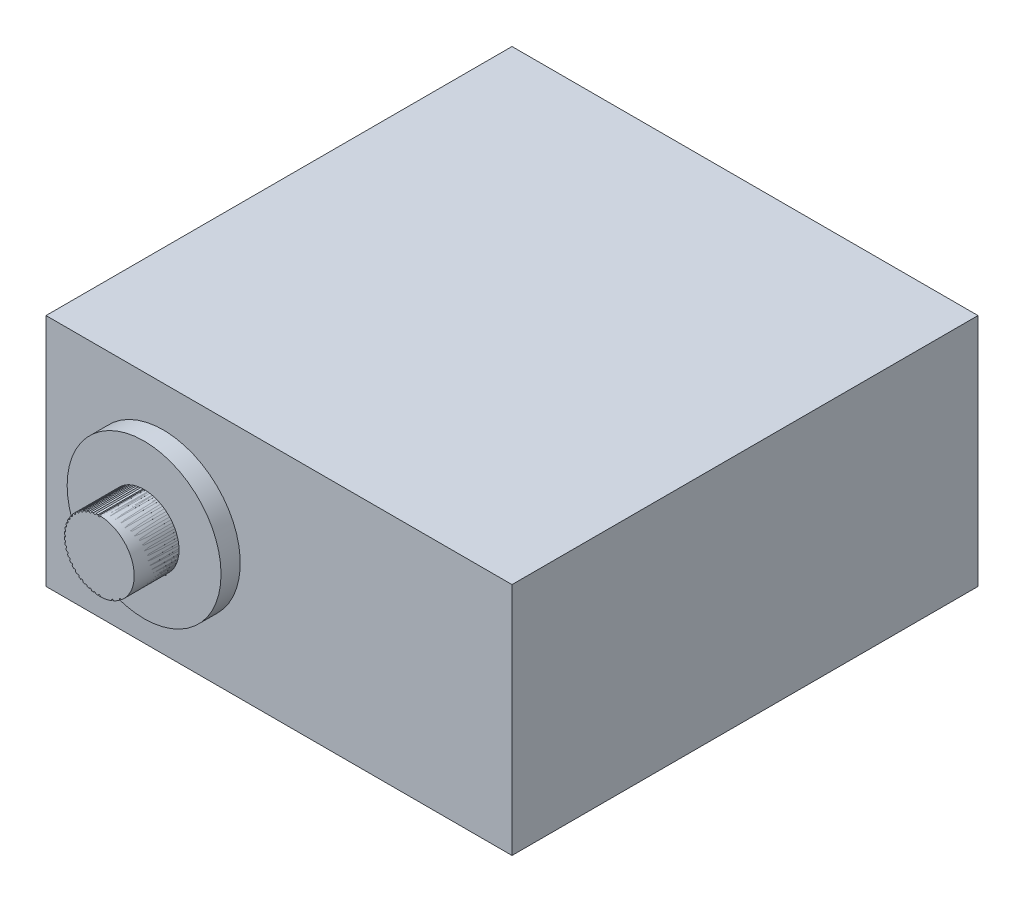
from build123d import *

# Parameters (mm, degrees)
SKETCH_1_W              = 40
SKETCH_1_H              = 20.14
EXTRUDE_1_DEPTH         = 40
SKETCH_2_R              = 6.605
SKETCH_2_R_2            = 3
EXTRUDE_2_DEPTH         = 1.65
SKETCH_3_R              = 3
EXTRUDE_3_DEPTH         = 5.5
SKETCH_4_R              = 6.605
SKETCH_4_R_2            = 3
EXTRUDE_4_DEPTH         = 1.65
SKETCH_5_R              = 3
EXTRUDE_5_DEPTH         = 5.55
CUT_EXTRUDE_START       = -3.9
CUT_EXTRUDE_1_OUTLINE_R = 0.1
CUT_EXTRUDE_1_DEPTH     = 3.9


# Read off the part's stored shape, not the designer's step: 切除-拉伸1
with BuildPart() as part:
    # 草图1 → 凸台-拉伸1 (new body)
    with BuildSketch(Plane.XY):
        Rectangle(SKETCH_1_W, SKETCH_1_H)
    extrude(amount=EXTRUDE_1_DEPTH)

    # 草图2 → 凸台-拉伸2 (add)
    with BuildSketch(Plane.XY.offset(40)):
        with Locations(Location((-9.93, 0, 0), (0, 0, 180))):
            Circle(SKETCH_2_R)
        with Locations((-9.93, 0)):
            Circle(SKETCH_2_R_2, mode=Mode.SUBTRACT)
    extrude(amount=EXTRUDE_2_DEPTH)

    # 草图3 → 凸台-拉伸3 (add)
    with BuildSketch(Plane.XY.offset(40)):
        with Locations((-9.93, 0)):
            Circle(SKETCH_3_R)
    extrude(amount=EXTRUDE_3_DEPTH)

    # 草图4 → 凸台-拉伸4 (add)
    with BuildSketch(Plane(origin=(0, 0, 0), x_dir=(-1, 0, 0), z_dir=(0, 0, -1))):
        with Locations((9.925, 0)):
            Circle(SKETCH_4_R)
        with Locations((9.925, 0)):
            Circle(SKETCH_4_R_2, mode=Mode.SUBTRACT)
    extrude(amount=EXTRUDE_4_DEPTH)

    # 草图5 → 凸台-拉伸5 (add)
    with BuildSketch(Plane(origin=(0, 0, 0), x_dir=(-1, 0, 0), z_dir=(0, 0, -1))):
        with Locations((9.925, 0)):
            Circle(SKETCH_5_R)
    extrude(amount=EXTRUDE_5_DEPTH)

    # 切除-拉伸1 outline → 切除-拉伸1 (cut)
    with BuildSketch(Plane.XY.offset(45.5).offset(CUT_EXTRUDE_START)):
        with BuildLine():
            ThreePointArc((-6.933434762, -0.09998611), (-6.931768095, 0), (-6.933434762, 0.09998611))
            ThreePointArc((-6.933434762, 0.09998611), (-7.031768095, 0), (-6.933434762, -0.09998611))
        make_face()
        with BuildLine():
            ThreePointArc((-6.972136725, 0.490491748), (-7.056577997, 0.378525958), (-6.946035113, 0.292230318))
            ThreePointArc((-6.946035113, 0.292230318), (-6.957433511, 0.391578577), (-6.972136725, 0.490491748))
        make_face()
        with BuildLine():
            ThreePointArc((-6.972136725, -0.490491748), (-6.957433511, -0.391578577), (-6.946035113, -0.292230318))
            ThreePointArc((-6.946035113, -0.292230318), (-7.056577997, -0.378525958), (-6.972136725, -0.490491748))
        make_face()
        with BuildLine():
            ThreePointArc((-7.061478802, 0.872604936), (-7.130583199, 0.750575231), (-7.009722183, 0.679446604))
            ThreePointArc((-7.009722183, 0.679446604), (-7.033990616, 0.776457135), (-7.061478802, 0.872604936))
        make_face()
        with BuildLine():
            ThreePointArc((-7.061478802, -0.872604936), (-7.033990616, -0.776457135), (-7.009722183, -0.679446604))
            ThreePointArc((-7.009722183, -0.679446604), (-7.130583199, -0.750575231), (-7.061478802, -0.872604936))
        make_face()
        with BuildLine():
            ThreePointArc((-7.199932325, 1.239787612), (-7.252517451, 1.109781954), (-7.123406269, 1.055037371))
            ThreePointArc((-7.123406269, 1.055037371), (-7.160129498, 1.148050297), (-7.199932325, 1.239787612))
        make_face()
        with BuildLine():
            ThreePointArc((-7.199932325, -1.239787612), (-7.160129498, -1.148050297), (-7.123406269, -1.055037371))
            ThreePointArc((-7.123406269, -1.055037371), (-7.252517451, -1.109781954), (-7.199932325, -1.239787612))
        make_face()
        with BuildLine():
            ThreePointArc((-7.385128314, 1.585757178), (-7.420294424, 1.45), (-7.285142204, 1.412576155))
            ThreePointArc((-7.285142204, 1.412576155), (-7.333691884, 1.5), (-7.385128314, 1.585757178))
        make_face()
        with BuildLine():
            ThreePointArc((-7.385128314, -1.585757178), (-7.333691884, -1.5), (-7.285142204, -1.412576155))
            ThreePointArc((-7.285142204, -1.412576155), (-7.420294424, -1.45), (-7.385128314, -1.585757178))
        make_face()
        with BuildLine():
            ThreePointArc((-7.613147502, 1.903680264), (-7.630347752, 1.764501178), (-7.491474668, 1.744983665))
            ThreePointArc((-7.491474668, 1.744983665), (-7.55098843, 1.825346045), (-7.613147502, 1.903680264))
        make_face()
        with BuildLine():
            ThreePointArc((-7.613147502, -1.903680264), (-7.55098843, -1.825346045), (-7.491474668, -1.744983665))
            ThreePointArc((-7.491474668, -1.744983665), (-7.630347752, -1.764501178), (-7.613147502, -1.903680264))
        make_face()
        with BuildLine():
            ThreePointArc((-7.882327119, 2.190842689), (-7.88115843, 2.050609665), (-7.740925406, 2.049440976))
            ThreePointArc((-7.740925406, 2.049440976), (-7.810447751, 2.121320344), (-7.882327119, 2.190842689))
        make_face()
        with BuildLine():
            ThreePointArc((-7.882327119, -2.190842689), (-7.810447751, -2.121320344), (-7.740925406, -2.049440976))
            ThreePointArc((-7.740925406, -2.049440976), (-7.88115843, -2.050609665), (-7.882327119, -2.190842689))
        make_face()
        with BuildLine():
            ThreePointArc((-8.185822725, 2.439605453), (-8.166359951, 2.300724687), (-8.027174096, 2.317870078))
            ThreePointArc((-8.027174096, 2.317870078), (-8.105483808, 2.380060021), (-8.185822725, 2.439605453))
        make_face()
        with Locations((-8.105483808, -2.380060021)):
            Circle(CUT_EXTRUDE_1_OUTLINE_R)
        with BuildLine():
            ThreePointArc((-8.51919194, 2.646625891), (-8.481768095, 2.511473671), (-8.346010917, 2.546639781))
            ThreePointArc((-8.346010917, 2.546639781), (-8.431768095, 2.598076212), (-8.51919194, 2.646625891))
        make_face()
        with BuildLine():
            ThreePointArc((-8.51919194, -2.646625891), (-8.431768095, -2.598076212), (-8.346010917, -2.546639781))
            ThreePointArc((-8.346010917, -2.546639781), (-8.481768095, -2.511473671), (-8.51919194, -2.646625891))
        make_face()
        with BuildLine():
            ThreePointArc((-8.875512581, 2.807903896), (-8.82082401, 2.678768979), (-8.690795553, 2.731297705))
            ThreePointArc((-8.690795553, 2.731297705), (-8.782515594, 2.771140323), (-8.875512581, 2.807903896))
        make_face()
        with Locations((-8.782515594, -2.771140323)):
            Circle(CUT_EXTRUDE_1_OUTLINE_R)
        with BuildLine():
            ThreePointArc((-9.252321491, 2.922045912), (-9.181192864, 2.801184896), (-9.059163159, 2.870289293))
            ThreePointArc((-9.059163159, 2.870289293), (-9.15531096, 2.897777479), (-9.252321491, 2.922045912))
        make_face()
        with BuildLine():
            ThreePointArc((-9.252321491, -2.922045912), (-9.15531096, -2.897777479), (-9.059163159, -2.870289293))
            ThreePointArc((-9.059163159, -2.870289293), (-9.181192864, -2.801184896), (-9.252321491, -2.922045912))
        make_face()
        with BuildLine():
            ThreePointArc((-9.639537777, 2.985732982), (-9.553242137, 2.875190098), (-9.441276347, 2.95963137))
            ThreePointArc((-9.441276347, 2.95963137), (-9.540189518, 2.974334584), (-9.639537777, 2.985732982))
        make_face()
        with BuildLine():
            ThreePointArc((-9.639537777, -2.985732982), (-9.540189518, -2.974334584), (-9.441276347, -2.95963137))
            ThreePointArc((-9.441276347, -2.95963137), (-9.553242137, -2.875190098), (-9.639537777, -2.985732982))
        make_face()
        with BuildLine():
            ThreePointArc((-10.031753197, 2.998273885), (-9.931738367, 2.900000004), (-9.831781985, 2.998333333))
            ThreePointArc((-9.831781985, 2.998333333), (-9.931768582, 3), (-10.031753197, 2.998273885))
        make_face()
        with BuildLine():
            ThreePointArc((-10.031755178, -2.998333301), (-9.931768582, -3), (-9.831781985, -2.998333333))
            ThreePointArc((-9.831781985, -2.998333333), (-9.931738367, -2.900000004), (-10.031755178, -2.998333301))
        make_face()
        with BuildLine():
            ThreePointArc((-10.422216845, 2.959344958), (-10.310236127, 2.875197741), (-10.223978869, 2.985561325))
            ThreePointArc((-10.223978869, 2.985561325), (-10.323316348, 2.974105286), (-10.422216845, 2.959344958))
        make_face()
        with BuildLine():
            ThreePointArc((-10.422216845, -2.959344958), (-10.323316348, -2.974105286), (-10.223978869, -2.985561325))
            ThreePointArc((-10.223978869, -2.985561325), (-10.310236127, -2.875197741), (-10.422216845, -2.959344958))
        make_face()
        with BuildLine():
            ThreePointArc((-10.804230244, 2.869794676), (-10.68228835, 2.801199644), (-10.611118169, 2.921656729))
            ThreePointArc((-10.611118169, 2.921656729), (-10.708106413, 2.897335053), (-10.804230244, 2.869794676))
        make_face()
        with BuildLine():
            ThreePointArc((-10.804230244, -2.869794676), (-10.708106413, -2.897335053), (-10.611118169, -2.921656729))
            ThreePointArc((-10.611118169, -2.921656729), (-10.68228835, -2.801199644), (-10.804230244, -2.869794676))
        make_face()
        with BuildLine():
            ThreePointArc((-11.171262224, 2.731166068), (-11.04149976, 2.67927149), (-10.986578735, 2.807782288))
            ThreePointArc((-10.986578735, 2.807782288), (-11.07955895, 2.771013212), (-11.171262224, 2.731166068))
        make_face()
        with BuildLine():
            ThreePointArc((-11.171262224, -2.731166068), (-11.07955895, -2.771013212), (-10.986578735, -2.807782288))
            ThreePointArc((-10.986578735, -2.807782288), (-11.04149976, -2.67927149), (-11.171262224, -2.731166068))
        make_face()
        with BuildLine():
            ThreePointArc((-11.517040579, 2.545840176), (-11.381723912, 2.511499195), (-11.343942874, 2.645895982))
            ThreePointArc((-11.343942874, 2.645895982), (-11.431325485, 2.597310491), (-11.517040579, 2.545840176))
        make_face()
        with BuildLine():
            ThreePointArc((-11.517040579, -2.545840176), (-11.431325485, -2.597310491), (-11.343942874, -2.645895982))
            ThreePointArc((-11.343942874, -2.645895982), (-11.381723912, -2.511499195), (-11.517040579, -2.545840176))
        make_face()
        with BuildLine():
            ThreePointArc((-11.834745795, 2.317745339), (-11.696232175, 2.301448799), (-11.67614372, 2.439463488))
            ThreePointArc((-11.67614372, 2.439463488), (-11.756458976, 2.379925967), (-11.834745795, 2.317745339))
        make_face()
        with BuildLine():
            ThreePointArc((-11.834745795, -2.317745339), (-11.756458976, -2.379925967), (-11.67614372, -2.439463488))
            ThreePointArc((-11.67614372, -2.439463488), (-11.696232175, -2.301448799), (-11.834745795, -2.317745339))
        make_face()
        with BuildLine():
            ThreePointArc((-12.121676667, 2.048549093), (-11.982348311, 2.050639128), (-11.980374357, 2.189969177))
            ThreePointArc((-11.980374357, 2.189969177), (-12.052203839, 2.12043648), (-12.121676667, 2.048549093))
        make_face()
        with BuildLine():
            ThreePointArc((-12.121676667, -2.048549093), (-12.052203839, -2.12043648), (-11.980374357, -2.189969177))
            ThreePointArc((-11.980374357, -2.189969177), (-11.982348311, -2.050639128), (-12.121676667, -2.048549093))
        make_face()
        with BuildLine():
            ThreePointArc((-12.370212095, 1.745097398), (-12.232470956, 1.765436599), (-12.248574024, 1.903736981))
            ThreePointArc((-12.248574024, 1.903736981), (-12.310714801, 1.825430644), (-12.370212095, 1.745097398))
        make_face()
        with BuildLine():
            ThreePointArc((-12.370212095, -1.745097398), (-12.310714801, -1.825430644), (-12.248574024, -1.903736981))
            ThreePointArc((-12.248574024, -1.903736981), (-12.232470956, -1.765436599), (-12.370212095, -1.745097398))
        make_face()
        with BuildLine():
            ThreePointArc((-12.577024299, 1.411829436), (-12.443227043, 1.450025509), (-12.477126402, 1.584975423))
            ThreePointArc((-12.477126402, 1.584975423), (-12.528517897, 1.499234718), (-12.577024299, 1.411829436))
        make_face()
        with BuildLine():
            ThreePointArc((-12.577024299, -1.411829437), (-12.528517897, -1.499234718), (-12.477126402, -1.584975423))
            ThreePointArc((-12.477126402, -1.584975423), (-12.443227043, -1.450025509), (-12.577024299, -1.411829437))
        make_face()
        with BuildLine():
            ThreePointArc((-12.738127903, 1.055659831), (-12.610528431, 1.11096493), (-12.661594431, 1.24031926))
            ThreePointArc((-12.661594431, 1.24031926), (-12.701399585, 1.148627154), (-12.738127903, 1.055659831))
        make_face()
        with BuildLine():
            ThreePointArc((-12.738127903, -1.055659831), (-12.701399585, -1.148627154), (-12.661594431, -1.24031926))
            ThreePointArc((-12.661594431, -1.24031926), (-12.610528431, -1.11096493), (-12.738127903, -1.055659831))
        make_face()
        with BuildLine():
            ThreePointArc((-12.852139719, 0.679043047), (-12.732949047, 0.750589957), (-12.800434802, 0.872126164))
            ThreePointArc((-12.800434802, 0.872126164), (-12.827895818, 0.776015354), (-12.852139719, 0.679043047))
        make_face()
        with BuildLine():
            ThreePointArc((-12.852139719, -0.679043047), (-12.827895818, -0.776015354), (-12.800434802, -0.872126164))
            ThreePointArc((-12.800434802, -0.872126164), (-12.732949047, -0.750589957), (-12.852139719, -0.679043047))
        make_face()
        with BuildLine():
            ThreePointArc((-12.915751102, 0.292045125), (-12.80695719, 0.37853358), (-12.889676355, 0.490220231))
            ThreePointArc((-12.889676355, 0.490220231), (-12.904364681, 0.3913499), (-12.915751102, 0.292045125))
        make_face()
        with BuildLine():
            ThreePointArc((-12.915751102, -0.292045125), (-12.904364681, -0.3913499), (-12.889676355, -0.49022023))
            ThreePointArc((-12.889676355, -0.49022023), (-12.80695719, -0.37853358), (-12.915751102, -0.292045125))
        make_face()
        with Locations((-12.931768095, 0)):
            Circle(CUT_EXTRUDE_1_OUTLINE_R)
    extrude(amount=CUT_EXTRUDE_1_DEPTH, mode=Mode.SUBTRACT)


solid = part.part
